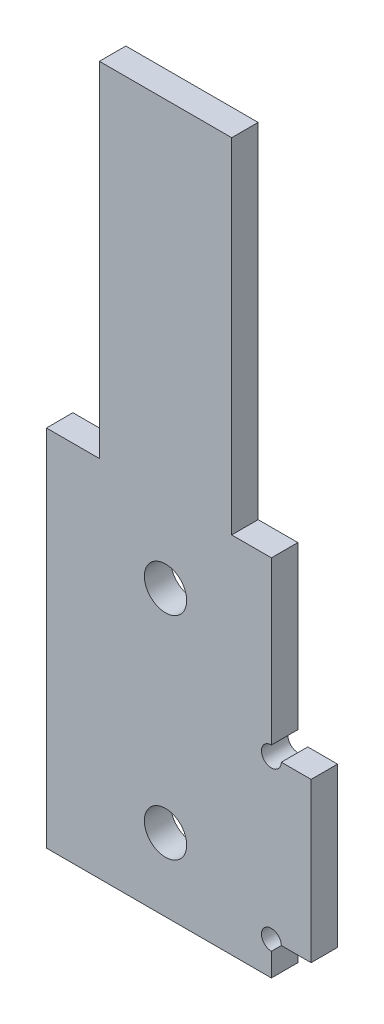
from build123d import *

# Parameters (mm, degrees)
EXTRUDE_1_DEPTH     = 2
SKETCH_2_R          = 1.6
CUT_EXTRUDE_1_DEPTH = 56.283360969
SKETCH_3_W          = 3
SKETCH_3_H          = 24
SKETCH_3_W_2        = 4
CUT_EXTRUDE_2_DEPTH = 56.283360969
SKETCH_4_W          = 10
SKETCH_4_H          = 2
EXTRUDE_2_DEPTH     = 2
SKETCH_5_R          = 0.75
CUT_EXTRUDE_3_DEPTH = 3


with BuildPart() as part:
    # 草图1 → 凸台-拉伸1 (new body)
    with BuildSketch(Plane.XY):
        Polygon((0, 0), (17, 0), (17, 2.5), (20, 2.5), (20, 14.5), (17, 14.5), (17, 51.5), (0, 51.5), align=None)
    extrude(amount=EXTRUDE_1_DEPTH)

    # 草图2 → 切除-拉伸1 (cut, through all)
    with BuildSketch(Plane.XY.offset(2)):
        with Locations((9, 5.5)):
            Circle(SKETCH_2_R)
        with Locations((9, 21.5)):
            Circle(SKETCH_2_R)
    extrude(amount=-CUT_EXTRUDE_1_DEPTH, mode=Mode.SUBTRACT)

    # 草图3 → 切除-拉伸2 (cut, through all)
    with BuildSketch(Plane.XY.offset(2)):
        with Locations((15.5, 39.5)):
            Rectangle(SKETCH_3_W, SKETCH_3_H)
        with Locations((2, 39.5)):
            Rectangle(SKETCH_3_W_2, SKETCH_3_H)
    extrude(amount=-CUT_EXTRUDE_2_DEPTH, mode=Mode.SUBTRACT)

    # 草图4 → 凸台-拉伸2 (add)
    with BuildSketch(Plane(origin=(0, 51.5, 0), x_dir=(1, 0, 0), z_dir=(0, 1, 0))):
        with Locations((9, -1)):
            Rectangle(SKETCH_4_W, SKETCH_4_H)
    extrude(amount=EXTRUDE_2_DEPTH)

    # 草图5 → 切除-拉伸3 (cut)
    with BuildSketch(Plane.XY.offset(2)):
        with Locations((17, 14.5)):
            Circle(SKETCH_5_R)
        with Locations((17, 2.5)):
            Circle(SKETCH_5_R)
    extrude(amount=-CUT_EXTRUDE_3_DEPTH, mode=Mode.SUBTRACT)


solid = part.part
